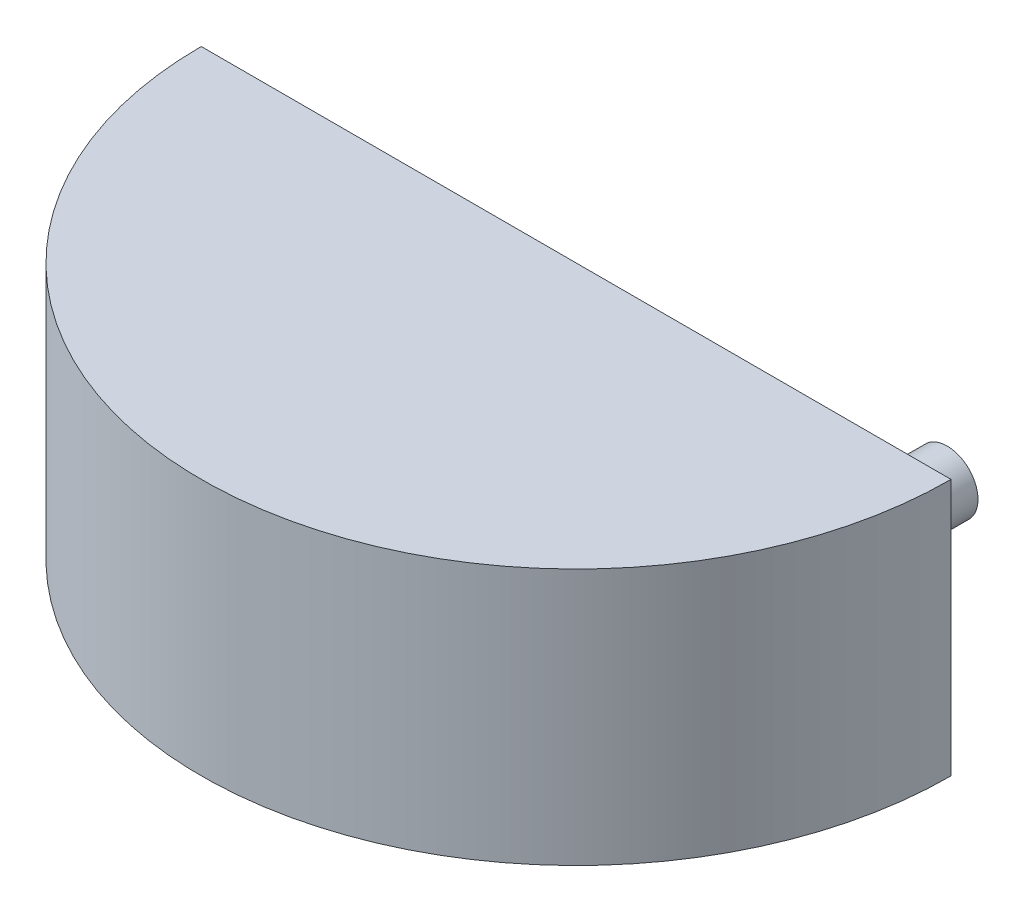
from build123d import *

# Parameters (mm, degrees)
SKETCH2_W           = 19.314156379
SKETCH2_H           = 10.14409312
CUT_EXTRUDE1_DEPTH  = 9.398
SKETCH3_R           = 1.190625
CUT_EXTRUDE2_DEPTH  = 3.048
SKETCH4_R           = 0.762
SKETCH4_R_2         = 0.8255
BOSS_EXTRUDE1_DEPTH = 0.79375
CUT_EXTRUDE3_START  = -1.5875
SKETCH6_R           = 0.8255
CUT_EXTRUDE3_DEPTH  = 1.5875
SKETCH7_W           = 1.5875
SKETCH7_H           = 6.35
BOSS_EXTRUDE2_DEPTH = 0.79375


with BuildPart() as part:
    # Sketch1 → Revolve1 (revolve)
    with BuildSketch(Plane.XY):
        Polygon((0, 1.5875), (0, 0), (9.271, 0), (9.271, 6.35), (0, 6.35), (0, 4.7625), (7.6835, 4.7625), (7.6835, 1.5875), align=None)
    revolve(axis=Axis((0, 0, 0), (0, 1, 0)))

    # Sketch2 → Cut-Extrude1 (cut)
    with BuildSketch(Plane(origin=(0, 6.35, 0), x_dir=(1, 0, 0), z_dir=(0, 1, 0))):
        with Locations((0.38607819, 5.07204656)):
            Rectangle(SKETCH2_W, SKETCH2_H)
    extrude(amount=-CUT_EXTRUDE1_DEPTH, mode=Mode.SUBTRACT)

    # Sketch3 → Cut-Extrude2 (cut)
    with BuildSketch(Plane.XZ):
        with Locations((5.30225, 0)):
            Circle(SKETCH3_R)
        with Locations((-5.30225, 0)):
            Circle(SKETCH3_R)
    extrude(amount=-CUT_EXTRUDE2_DEPTH, mode=Mode.SUBTRACT)

    # Sketch4 → Boss-Extrude1 (add)
    with BuildSketch(Plane(origin=(0, 0, 0), x_dir=(-1, 0, 0), z_dir=(0, 0, -1))):
        with Locations((-8.382, 5.461)):
            Circle(SKETCH4_R)
        with Locations((-8.382, 0.889)):
            Circle(SKETCH4_R_2)
        with Locations((8.382, 5.461)):
            Circle(SKETCH4_R_2)
        with Locations((8.382, 0.889)):
            Circle(SKETCH4_R)
    extrude(amount=BOSS_EXTRUDE1_DEPTH)

    # Sketch6 → Cut-Extrude3 (cut)
    with BuildSketch(Plane(origin=(0, 0, -0.79375), x_dir=(-1, 0, 0), z_dir=(0, 0, -1)).offset(CUT_EXTRUDE3_START)):
        with Locations((-8.382, 0.889)):
            Circle(SKETCH6_R)
        with Locations((8.382, 5.461)):
            Circle(SKETCH6_R)
    extrude(amount=CUT_EXTRUDE3_DEPTH, mode=Mode.SUBTRACT)

    # Sketch7 → Boss-Extrude2 (add)
    with BuildSketch(Plane.XZ):
        with Locations((0, 3.175)):
            Rectangle(SKETCH7_W, SKETCH7_H)
    extrude(amount=BOSS_EXTRUDE2_DEPTH)


solid = part.part
